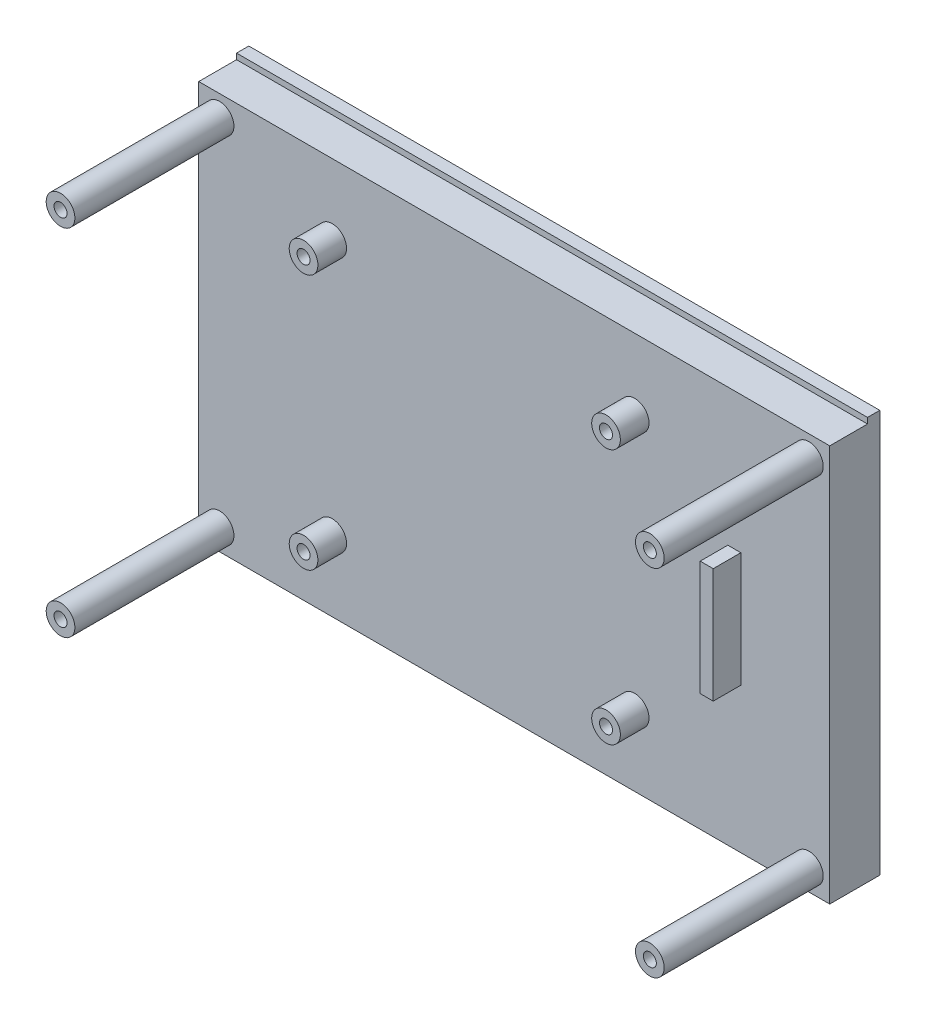
from build123d import *

# Parameters (mm, degrees)
ESQUISSE1_W             = 121
ESQUISSE1_H             = 76.1
BOSS_EXTRU_1_DEPTH      = 7.25
ESQUISSE3_W             = 121
ESQUISSE3_H             = 77.2
BOSS_EXTRU_3_DEPTH      = 2.35
ESQUISSE2_R             = 2.75
ESQUISSE2_R_2           = 1.25
BOSS_EXTRU_2_DEPTH      = 5.5
ESQUISSE4_W             = 108.4
ESQUISSE4_H             = 65.7
ENL_V_MAT_EXTRU_1_DEPTH = 1
ESQUISSE5_W             = 2.5
ESQUISSE5_H             = 22
BOSS_EXTRU_4_DEPTH      = 5.3
ESQUISSE8_R             = 2.75
ESQUISSE8_R_2           = 1.25
SPACERS_DEPTH           = 25


with BuildPart() as part:
    # Esquisse1 → Boss.-Extru.1 (new body)
    with BuildSketch(Plane.XY):
        Rectangle(ESQUISSE1_W, ESQUISSE1_H)
    extrude(amount=BOSS_EXTRU_1_DEPTH)

    # Esquisse3 → Boss.-Extru.3 (add)
    with BuildSketch(Plane(origin=(0, 0, 0), x_dir=(-1, 0, 0), z_dir=(0, 0, -1))):
        with Locations((0, 0.55)):
            Rectangle(ESQUISSE3_W, ESQUISSE3_H)
    extrude(amount=BOSS_EXTRU_3_DEPTH)

    # Esquisse2 → Boss.-Extru.2 (add)
    # profile 1 of 8: a face of its own
    with BuildSketch(Plane.XY.offset(7.25)):
        with Locations((-34.9, 24.5)):
            Circle(ESQUISSE2_R)
        with Locations((-34.9, 24.5)):
            Circle(ESQUISSE2_R_2, mode=Mode.SUBTRACT)
    # profile 2 of 8: a face of its own
    with BuildSketch(Plane.XY.offset(7.25)):
        with Locations((23.1, 24.5)):
            Circle(ESQUISSE2_R)
        with Locations((23.1, 24.5)):
            Circle(ESQUISSE2_R_2, mode=Mode.SUBTRACT)
    # profile 3 of 8: a face of its own
    with BuildSketch(Plane.XY.offset(7.25)):
        with Locations((23.1, -24.5)):
            Circle(ESQUISSE2_R)
        with Locations((23.1, -24.5)):
            Circle(ESQUISSE2_R_2, mode=Mode.SUBTRACT)
    # profile 4 of 8: a face of its own
    with BuildSketch(Plane.XY.offset(7.25)):
        with Locations((-34.9, -24.5)):
            Circle(ESQUISSE2_R)
        with Locations((-34.9, -24.5)):
            Circle(ESQUISSE2_R_2, mode=Mode.SUBTRACT)
    # profile 5 of 8: a face of its own
    with BuildSketch(Plane.XY.offset(7.25)):
        with Locations((-56.5, 34)):
            Circle(ESQUISSE2_R)
        with Locations((-56.5, 34)):
            Circle(ESQUISSE2_R_2, mode=Mode.SUBTRACT)
    # profile 6 of 8: a face of its own
    with BuildSketch(Plane.XY.offset(7.25)):
        with Locations((56.5, 34)):
            Circle(ESQUISSE2_R)
        with Locations((56.5, 34)):
            Circle(ESQUISSE2_R_2, mode=Mode.SUBTRACT)
    # profile 7 of 8: a face of its own
    with BuildSketch(Plane.XY.offset(7.25)):
        with Locations((56.5, -34)):
            Circle(ESQUISSE2_R)
        with Locations((56.5, -34)):
            Circle(ESQUISSE2_R_2, mode=Mode.SUBTRACT)
    # profile 8 of 8: a face of its own
    with BuildSketch(Plane.XY.offset(7.25)):
        with Locations((-56.5, -34)):
            Circle(ESQUISSE2_R)
        with Locations((-56.5, -34)):
            Circle(ESQUISSE2_R_2, mode=Mode.SUBTRACT)
    extrude(amount=BOSS_EXTRU_2_DEPTH)

    # Esquisse4 → Enlèv. mat.-Extru.1 (cut)
    with BuildSketch(Plane(origin=(0, 0, -2.35), x_dir=(-1, 0, 0), z_dir=(0, 0, -1))):
        with Locations((0, -2.2)):
            Rectangle(ESQUISSE4_W, ESQUISSE4_H)
    extrude(amount=-ENL_V_MAT_EXTRU_1_DEPTH, mode=Mode.SUBTRACT)

    # Esquisse5 → Boss.-Extru.4 (add)
    with BuildSketch(Plane.XY.offset(7.25)):
        with Locations((42.20796887, 0.781518688)):
            Rectangle(ESQUISSE5_W, ESQUISSE5_H)
    extrude(amount=BOSS_EXTRU_4_DEPTH)

    # Esquisse8 → spacers (add)
    # profile 1 of 4: a face of its own
    with BuildSketch(Plane.XY.offset(12.75)):
        with Locations((-56.5, -34)):
            Circle(ESQUISSE8_R)
        with Locations((-56.5, -34)):
            Circle(ESQUISSE8_R_2, mode=Mode.SUBTRACT)
    # profile 2 of 4: a face of its own
    with BuildSketch(Plane.XY.offset(12.75)):
        with Locations((-56.5, 34)):
            Circle(ESQUISSE8_R)
        with Locations((-56.5, 34)):
            Circle(ESQUISSE8_R_2, mode=Mode.SUBTRACT)
    # profile 3 of 4: a face of its own
    with BuildSketch(Plane.XY.offset(12.75)):
        with Locations((56.5, 34)):
            Circle(ESQUISSE8_R)
        with Locations((56.5, 34)):
            Circle(ESQUISSE8_R_2, mode=Mode.SUBTRACT)
    # profile 4 of 4: a face of its own
    with BuildSketch(Plane.XY.offset(12.75)):
        with Locations((56.5, -34)):
            Circle(ESQUISSE8_R)
        with Locations((56.5, -34)):
            Circle(ESQUISSE8_R_2, mode=Mode.SUBTRACT)
    extrude(amount=SPACERS_DEPTH)


solid = part.part
